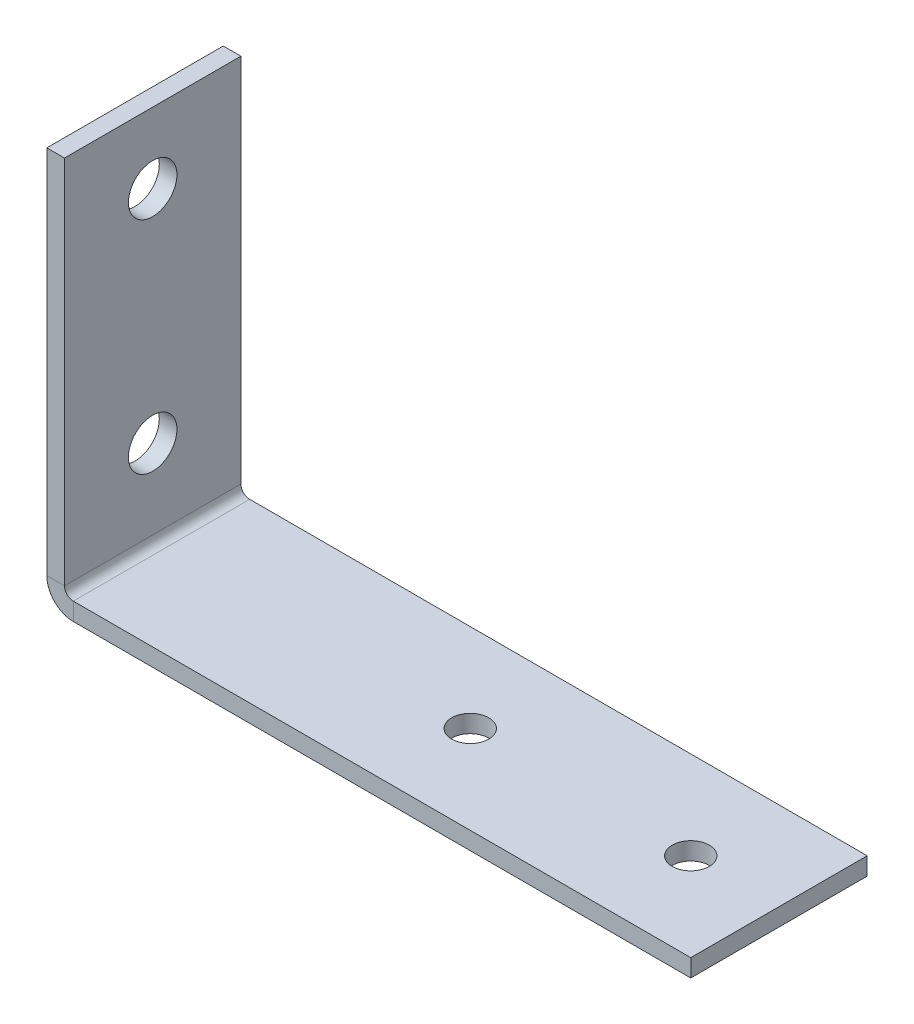
from build123d import *

# Parameters (mm, degrees)
SKETCH_1_W             = 70
SKETCH_1_H             = 20
SM_BASE_FLANGE_1_DEPTH = 2
SM_EDGE_FLANGE_1_DEPTH = 20
MM_1_D                 = 5.5
MM_1_DEPTH             = 8
MM_1_TIP               = 1.652366702
HOLE_WIZARD_M5_1_D     = 4.2
HOLE_WIZARD_M5_1_DEPTH = 12.4
HOLE_WIZARD_M5_1_TIP   = 1.2618073


# Sheet-metal steps are written as plain solids
with BuildPart() as part:
    # Sketch 1 → 基体-法兰1 (new body)
    with BuildSketch(Plane(origin=(0, 0, 0), x_dir=(1, 0, 0), z_dir=(0, 1, 0))):
        with Locations((0, 10)):
            Rectangle(SKETCH_1_W, SKETCH_1_H)
    extrude(amount=-SM_BASE_FLANGE_1_DEPTH)

    # 边线-法兰1 section (across the edge) → 边线-法兰1 (add)
    with BuildSketch(Plane(origin=(-36, 0, -20), x_dir=(1, 0, 0), z_dir=(0, 0, 1))):
        with BuildLine():
            Line((-2, 1), (-2, 43))
            Line((-2, 43), (0, 43))
            Line((0, 43), (0, 1))
            ThreePointArc((0, 1), (0.292893219, 0.292893219), (1, 0))
            Line((1, 0), (1, -2))
            ThreePointArc((1, -2), (-1.121320344, -1.121320344), (-2, 1))
        make_face()
    extrude(amount=SM_EDGE_FLANGE_1_DEPTH)

    # 大小mm 暗销孔1
    with Locations(Plane(origin=(-36, 35, -10), x_dir=(0, 1, 0), z_dir=(1, 0, 0))):
        with Locations((0, 0), (-25, 0)):
            Hole(MM_1_D / 2, depth=MM_1_DEPTH)
            with Locations((0, 0, -(MM_1_DEPTH + MM_1_TIP / 2))):  # 118° drill point
                Cone(0, MM_1_D / 2, MM_1_TIP, mode=Mode.SUBTRACT)

    # M5 螺纹孔1
    with Locations(Plane(origin=(0, 0, -10), x_dir=(0, 0, 1), z_dir=(0, 1, 0))):
        with Locations((0, 0), (0, 25), (-27.106002663, 33.534976499)):
            Hole(HOLE_WIZARD_M5_1_D / 2, depth=HOLE_WIZARD_M5_1_DEPTH)
            with Locations((0, 0, -(HOLE_WIZARD_M5_1_DEPTH + HOLE_WIZARD_M5_1_TIP / 2))):  # 118° drill point
                Cone(0, HOLE_WIZARD_M5_1_D / 2, HOLE_WIZARD_M5_1_TIP, mode=Mode.SUBTRACT)


solid = part.part
